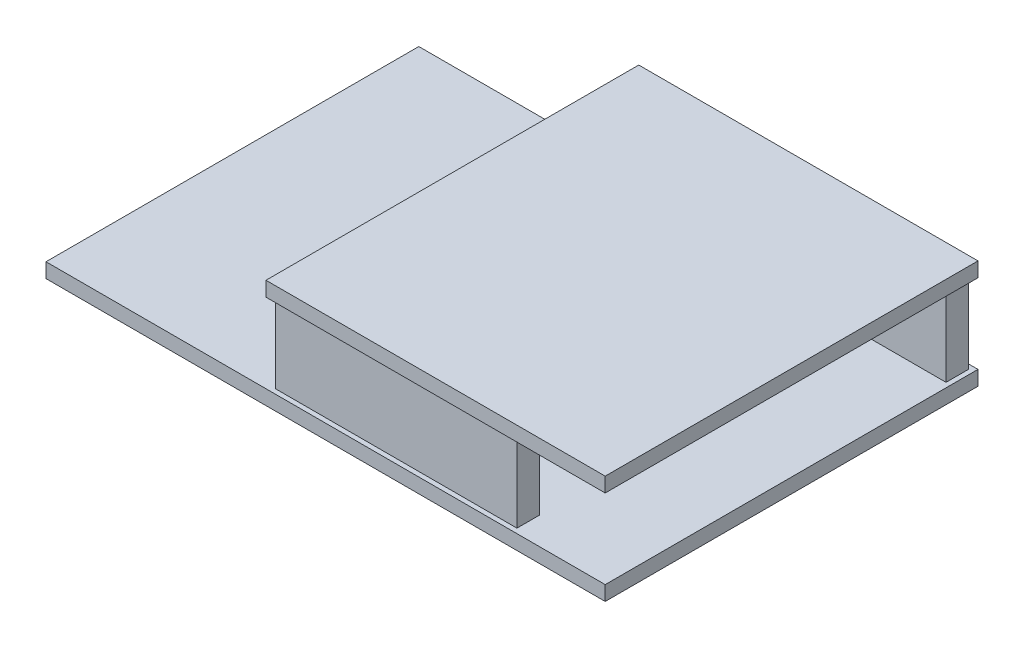
from build123d import *

# Parameters (mm, degrees)
SKETCH1_W           = 60
SKETCH1_H           = 40
BOSS_EXTRUDE1_DEPTH = 1.57
SKETCH2_W           = 25.91
SKETCH2_H           = 2.41
BOSS_EXTRUDE2_DEPTH = 8.51
SKETCH3_W           = 36.4
SKETCH3_H           = 40
BOSS_EXTRUDE3_DEPTH = 1.57


with BuildPart() as part:
    # Sketch1 → Boss-Extrude1 (new body)
    with BuildSketch(Plane(origin=(0, 0, 0), x_dir=(1, 0, 0), z_dir=(0, 1, 0))):
        Rectangle(SKETCH1_W, SKETCH1_H)
    extrude(amount=BOSS_EXTRUDE1_DEPTH)

    # Sketch2 → Boss-Extrude2 (add)
    with BuildSketch(Plane(origin=(0, 1.57, 0), x_dir=(1, 0, 0), z_dir=(0, 1, 0))):
        with Locations((16.535, 18.285)):
            Rectangle(SKETCH2_W, SKETCH2_H)
        with Locations((7.065, -18.285)):
            Rectangle(SKETCH2_W, SKETCH2_H)
    extrude(amount=BOSS_EXTRUDE2_DEPTH)

    # Sketch3 → Boss-Extrude3 (add)
    with BuildSketch(Plane(origin=(0, 10.08, 0), x_dir=(1, 0, 0), z_dir=(0, 1, 0))):
        with Locations((11.8, 0)):
            Rectangle(SKETCH3_W, SKETCH3_H)
    extrude(amount=BOSS_EXTRUDE3_DEPTH)


solid = part.part
